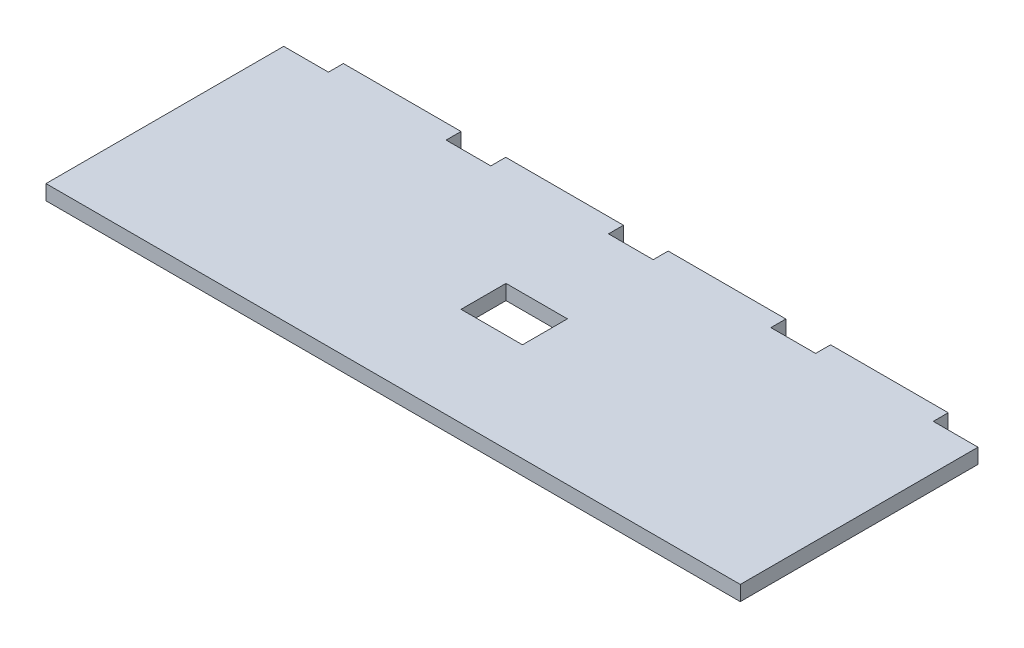
from build123d import *

# Parameters (mm, degrees)
SKETCH1_W           = 26.1
SKETCH1_H           = 19.1
BOSS_EXTRUDE1_DEPTH = 6.35


with BuildPart() as part:
    # Sketch1 → Boss-Extrude1 (new body)
    with BuildSketch(Plane(origin=(0, 0, 0), x_dir=(1, 0, 0), z_dir=(0, 1, 0))):
        Polygon((0, 0), (0, -101), (295, -101), (295, 0), (276, 0), (276, 6.35), (226, 6.35), (226, 0), (207, 0), (207, 6.35), (157, 6.35), (157, 0), (138, 0), (138, 6.35), (88, 6.35), (88, 0), (69, 0), (69, 6.35), (19, 6.35), (19, 0), align=None)
        with Locations((147.5, -49.55)):
            Rectangle(SKETCH1_W, SKETCH1_H, mode=Mode.SUBTRACT)
    extrude(amount=BOSS_EXTRUDE1_DEPTH)


solid = part.part
